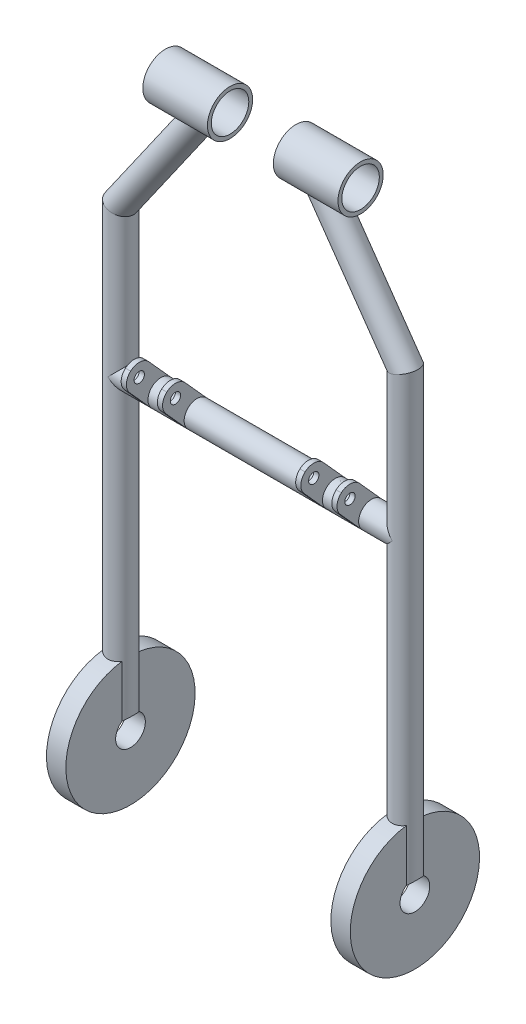
from build123d import *

# Parameters (mm, degrees)
CROQUIS1_R                               = 17.5
CROQUIS1_R_2                             = 14.5
SALIENTE_EXTRUIR1_DEPTH                  = 50
CROQUIS3_R                               = 10
CROQUIS3_R_2                             = 7
CROQUIS4_R                               = 14.5
CORTAR_EXTRUIR1_DEPTH                    = 463.597108113
SALIENTE_EXTRUIR2_REACH                  = 457.593
CROQUIS6_R                               = 17.5
CROQUIS6_R_2                             = 14.5
SALIENTE_EXTRUIR3_DEPTH                  = 50
CROQUIS8_R                               = 10
CROQUIS8_R_2                             = 7
SALIENTE_EXTRUIR4_REACH                  = 410.854
SALIENTE_EXTRUIR5_REACH                  = 495.244
SALIENTE_EXTRUIR5_END_RADIUS             = 10
CROQUIS10_R                              = 10
SALIENTE_EXTRUIR5_DIRECTION_2_REACH      = 495.244
SALIENTE_EXTRUIR5_DIRECTION_2_END_RADIUS = 10
CROQUIS12_R                              = 50
SALIENTE_EXTRUIR6_DEPTH                  = 7.5
CHAFL_N3_SIZE                            = 7
CHAFL_N4_SIZE                            = 7
CROQUIS14_R                              = 50
SALIENTE_EXTRUIR8_DEPTH                  = 7.5
CROQUIS15_R                              = 14.5
CORTAR_EXTRUIR2_DEPTH                    = 542.510293525
SALIENTE_EXTRUIR10_REACH                 = 346.39
SALIENTE_EXTRUIR10_END_RADIUS            = 10
CROQUIS17_W                              = 4
CROQUIS17_H                              = 20
REDONDEO1_R                              = 10
CROQUIS18_R                              = 4
CORTAR_EXTRUIR3_DEPTH                    = 545.263183217
CROQUIS19_R                              = 11.5
CORTAR_EXTRUIR4_DEPTH                    = 563.387736126


# Some blends are built 0.0001 mm under size
with BuildPart() as part:
    # Croquis1 → Saliente-Extruir1 (new body)
    with BuildSketch(Plane(origin=(0, 0, 0), x_dir=(0, 0, -1), z_dir=(1, 0, 0))):
        Circle(CROQUIS1_R)
        Circle(CROQUIS1_R_2, mode=Mode.SUBTRACT)
    extrude(amount=SALIENTE_EXTRUIR1_DEPTH)

    # Barrer1: sweep along a path in Croquis2
    with BuildLine(Plane.XY) as barrer1_path:
        Line((25, -17.5), (-34.517640748, -102.5))
        Line((-34.517640748, -102.5), (-34.517640748, -452.5))
    # Croquis3 → Barrer1 (sweep)
    with BuildSketch(Plane(origin=(25, -17.5, 0), x_dir=(0, 0, 1), z_dir=(-0.5735764363510502, -0.819152044288989, 0))):
        Circle(CROQUIS3_R)
        Circle(CROQUIS3_R_2, mode=Mode.SUBTRACT)
    sweep(path=barrer1_path.line, transition=Transition.RIGHT)

    # Croquis4 → Cortar-Extruir1 (cut, through all)
    with BuildSketch(Plane(origin=(50, 0, 0), x_dir=(0, 0, -1), z_dir=(1, 0, 0))):
        Circle(CROQUIS4_R)
    extrude(amount=-CORTAR_EXTRUIR1_DEPTH, mode=Mode.SUBTRACT)

    # Croquis5 → Saliente-Extruir2 (add, up to next)
    with BuildSketch(Plane(origin=(0.002437777, 0.003481506, 0), x_dir=(0.819152044288989, -0.5735764363510502, 0), z_dir=(0.5735764363510502, 0.819152044288989, 0)), mode=Mode.PRIVATE) as saliente_extruir2_sk1:
        with BuildLine():
            ThreePointArc((40.516388743, 0), (35.831900919, 8.470261525), (26.167322681, 9.004755654))
            add(Edge.make_bspline(
                [(28.247612565, 6.622133693), (27.366057866, 7.858998807), (26.167322681, 9.004755654)],
                knots=[3.529668062, 3.529668062, 3.529668062, 3.682084122, 3.682084122, 3.682084122], degree=2, weights=[1, 0.997097573, 1]))
            ThreePointArc((28.247612565, 6.622133693), (34.585698682, 5.695675256), (37.516388743, 0))
            ThreePointArc((37.516388743, 0), (34.585698682, -5.695675256), (28.247612565, -6.622133693))
            add(Edge.make_bspline(
                [(26.167322681, -9.004755654), (27.366057866, -7.858998807), (28.247612565, -6.622133693)],
                knots=[2.601101186, 2.601101186, 2.601101186, 2.753517245, 2.753517245, 2.753517245], degree=2, weights=[1, 0.997097573, 1]))
            ThreePointArc((26.167322681, -9.004755654), (35.831900919, -8.470261525), (40.516388743, 0))
        make_face()
    saliente_extruir2_tool1 = extrude(saliente_extruir2_sk1.sketch, amount=SALIENTE_EXTRUIR2_REACH, mode=Mode.PRIVATE) - part.part
    add(saliente_extruir2_tool1.solids().sort_by_distance((29.247034, -20.473805, 8.261766))[0])



with BuildPart() as body_2:
    # Croquis6 → Saliente-Extruir3 (new body)
    with BuildSketch(Plane(origin=(101, 0, 0), x_dir=(0, 0, -1), z_dir=(1, 0, 0))):
        Circle(CROQUIS6_R)
        Circle(CROQUIS6_R_2, mode=Mode.SUBTRACT)
    extrude(amount=SALIENTE_EXTRUIR3_DEPTH)

    # Barrer2: sweep along a path in Croquis7
    with BuildLine(Plane.XY) as barrer2_path:
        Line((126, -17.5), (185.517640748, -102.5))
        Line((185.517640748, -102.5), (185.517640748, -452.5))
    # Croquis8 → Barrer2 (sweep)
    with BuildSketch(Plane(origin=(126, -17.5, 0), x_dir=(-0.8191520442889888, -0.5735764363510505, 0), z_dir=(0.5735764363510504, -0.8191520442889887, 0))):
        Circle(CROQUIS8_R)
        Circle(CROQUIS8_R_2, mode=Mode.SUBTRACT)
    sweep(path=barrer2_path.line, transition=Transition.RIGHT)

    # Croquis9 → Saliente-Extruir4 (add, up to next)
    with BuildSketch(Plane(origin=(49.675041402, -70.943311364, 0), x_dir=(0.8191520442889889, 0.5735764363510504, 0), z_dir=(-0.5735764363510504, 0.8191520442889889, 0)), mode=Mode.PRIVATE) as saliente_extruir4_sk1:
        with BuildLine():
            ThreePointArc((95.444346122, 6.622133693), (86.175569944, 0), (95.444346122, -6.622133693))
            add(Edge.make_bspline(
                [(95.444346122, -6.622133693), (96.325900821, -7.858998807), (97.524636006, -9.004755654)],
                knots=[0.388075408, 0.388075408, 0.388075408, 0.540491468, 0.540491468, 0.540491468], degree=2, weights=[1, 0.997097573, 1]))
            ThreePointArc((97.524636006, -9.004755654), (83.175569944, 0), (97.524636006, 9.004755654))
            add(Edge.make_bspline(
                [(97.524636006, 9.004755654), (96.325900821, 7.858998807), (95.444346122, 6.622133693)],
                knots=[5.742693839, 5.742693839, 5.742693839, 5.895109899, 5.895109899, 5.895109899], degree=2, weights=[1, 0.997097573, 1]))
        make_face()
    saliente_extruir4_tool1 = extrude(saliente_extruir4_sk1.sketch, amount=SALIENTE_EXTRUIR4_REACH, mode=Mode.PRIVATE) - body_2.part
    add(saliente_extruir4_tool1.solids().sort_by_distance((128.512844, -15.740488, -8.024705))[0])


with BuildPart() as part_1:
    add(part.part)

    add(body_2.part)  # Saliente-Extruir5 merges body 2
    # Saliente-Extruir5: up to this cylinder (the profile starts outside it)
    saliente_extruir5_end = Plane(origin=(185.517640748, -214.361407, 0), z_dir=(0, -1, 0)) * Cylinder(SALIENTE_EXTRUIR5_END_RADIUS, 1011.488, mode=Mode.PRIVATE)
    # Croquis10 → Saliente-Extruir5 (add, up to the surface)
    with BuildSketch(Plane(origin=(0, 0, 0), x_dir=(0, 0, -1), z_dir=(1, 0, 0)), mode=Mode.PRIVATE) as saliente_extruir5_sk1:
        with Locations(Location((0, -214.361406616, 0), (0, 0, 180))):
            Circle(CROQUIS10_R)
    saliente_extruir5_tool1 = extrude(saliente_extruir5_sk1.sketch, amount=SALIENTE_EXTRUIR5_REACH, mode=Mode.PRIVATE) - saliente_extruir5_end
    add(saliente_extruir5_tool1.solids().sort_by_distance((0, -214.361407, 0))[0])

    # Saliente-Extruir5 direction 2: up to this cylinder (the profile starts outside it)
    saliente_extruir5_direction_2_end = Plane(origin=(-34.517640748, -214.361407, 0), z_dir=(0, -1, 0)) * Cylinder(SALIENTE_EXTRUIR5_DIRECTION_2_END_RADIUS, 1011.488, mode=Mode.PRIVATE)
    # Croquis10 → Saliente-Extruir5 direction 2 (add, up to the surface)
    with BuildSketch(Plane(origin=(0, 0, 0), x_dir=(0, 0, -1), z_dir=(1, 0, 0)), mode=Mode.PRIVATE) as saliente_extruir5_direction_2_sk1:
        with Locations(Location((0, -214.361406616, 0), (0, 0, 180))):
            Circle(CROQUIS10_R)
    saliente_extruir5_direction_2_tool1 = extrude(saliente_extruir5_direction_2_sk1.sketch, amount=-SALIENTE_EXTRUIR5_DIRECTION_2_REACH, mode=Mode.PRIVATE) - saliente_extruir5_direction_2_end
    add(saliente_extruir5_direction_2_tool1.solids().sort_by_distance((0, -214.361407, 0))[0])

    # Croquis12 → Saliente-Extruir6 (add, symmetric)
    with BuildSketch(Plane(origin=(-34.517640748, -452.5, 0), x_dir=(0, 0, 1), z_dir=(-1, 0, 0))):
        Circle(CROQUIS12_R)
    extrude(amount=SALIENTE_EXTRUIR6_DEPTH, both=True)

    # Chaflán3
    # the kernel refuses this chamfer: 7 mm, written as the material it takes off along each edge
    with BuildSketch(Plane(origin=(-34.517640748, -452.5, 0), x_dir=(-0.8149995055936188, 0, -0.5794616517787495), z_dir=(-0.5794616517787495, 0, 0.8149995055936188))) as chafl_n3_piece_1_section:
        Polygon((10, -CHAFL_N3_SIZE), (10 - CHAFL_N3_SIZE, 0), (10, 0), align=None)
    chafl_n3_piece_1 = revolve(axis=Axis((-34.517640748, -452.5, 0), (0, -1, 0)), revolution_arc=289.174626006, mode=Mode.PRIVATE)
    chafl_n3_piece_1 = split(chafl_n3_piece_1, bisect_by=Plane(origin=(-27.017640748, -449.451263522, 0), z_dir=(1, 0, 0)), keep=Keep.TOP, mode=Mode.PRIVATE)
    add(chafl_n3_piece_1, mode=Mode.SUBTRACT)

    # Chaflán4
    # the kernel refuses this chamfer: 7 mm, written as the material it takes off along each edge
    with BuildSketch(Plane(origin=(-34.517640748, -452.5, 0), x_dir=(0.8149995055936291, 0, 0.5794616517787353), z_dir=(0.5794616517787353, 0, -0.8149995055936291))) as chafl_n4_piece_1_section:
        Polygon((10, -CHAFL_N4_SIZE), (10 - CHAFL_N4_SIZE, 0), (10, 0), align=None)
    chafl_n4_piece_1 = revolve(axis=Axis((-34.517640748, -452.5, 0), (0, -1, 0)), revolution_arc=289.174626006, mode=Mode.PRIVATE)
    chafl_n4_piece_1 = split(chafl_n4_piece_1, bisect_by=Plane(origin=(-42.017640748, -449.451263522, 0), z_dir=(-1, 0, 0)), keep=Keep.TOP, mode=Mode.PRIVATE)
    add(chafl_n4_piece_1, mode=Mode.SUBTRACT)

    # Croquis14 → Saliente-Extruir8 (add, symmetric)
    with BuildSketch(Plane(origin=(185.517640748, -452.5, 0), x_dir=(0, 0, 1), z_dir=(-1, 0, 0))):
        Circle(CROQUIS14_R)
    extrude(amount=SALIENTE_EXTRUIR8_DEPTH, both=True)

    # Croquis15 → Cortar-Extruir2 (cut, through all)
    with BuildSketch(Plane(origin=(151, 0, 0), x_dir=(0, 0, -1), z_dir=(1, 0, 0))):
        Circle(CROQUIS15_R)
    extrude(amount=-CORTAR_EXTRUIR2_DEPTH, mode=Mode.SUBTRACT)

    # Saliente-Extruir10: up to this cylinder (the profile starts outside it)
    saliente_extruir10_end = Plane(origin=(76, -214.361406616, 0), z_dir=(-1, 0, 0)) * Cylinder(SALIENTE_EXTRUIR10_END_RADIUS, 876.78, mode=Mode.PRIVATE)
    # Croquis17 → Saliente-Extruir10 (add, up to the surface)
    with BuildSketch(Plane(origin=(75, -188.351337725, 23.419571223), x_dir=(1, 0, 0), z_dir=(0, 0.7431448254773934, 0.6691306063588592)), mode=Mode.PRIVATE) as saliente_extruir10_sk1:
        with Locations((-80.5, 0)):
            Rectangle(CROQUIS17_W, CROQUIS17_H)
    saliente_extruir10_tool1 = extrude(saliente_extruir10_sk1.sketch, amount=-SALIENTE_EXTRUIR10_REACH, mode=Mode.PRIVATE) - saliente_extruir10_end
    add(saliente_extruir10_tool1.solids().sort_by_distance((-5.5, -188.351338, 23.419571))[0])
    # Croquis17 → Saliente-Extruir10 (add, up to the surface)
    with BuildSketch(Plane(origin=(75, -188.351337725, 23.419571223), x_dir=(1, 0, 0), z_dir=(0, 0.7431448254773934, 0.6691306063588592)), mode=Mode.PRIVATE) as saliente_extruir10_sk2:
        with Locations((-52.5, 0)):
            Rectangle(CROQUIS17_W, CROQUIS17_H)
    saliente_extruir10_tool2 = extrude(saliente_extruir10_sk2.sketch, amount=-SALIENTE_EXTRUIR10_REACH, mode=Mode.PRIVATE) - saliente_extruir10_end
    add(saliente_extruir10_tool2.solids().sort_by_distance((22.5, -188.351338, 23.419571))[0])
    # Croquis17 → Saliente-Extruir10 (add, up to the surface)
    with BuildSketch(Plane(origin=(75, -188.351337725, 23.419571223), x_dir=(1, 0, 0), z_dir=(0, 0.7431448254773934, 0.6691306063588592)), mode=Mode.PRIVATE) as saliente_extruir10_sk3:
        with Locations((54.5, 0)):
            Rectangle(CROQUIS17_W, CROQUIS17_H)
    saliente_extruir10_tool3 = extrude(saliente_extruir10_sk3.sketch, amount=-SALIENTE_EXTRUIR10_REACH, mode=Mode.PRIVATE) - saliente_extruir10_end
    add(saliente_extruir10_tool3.solids().sort_by_distance((129.5, -188.351338, 23.419571))[0])
    # Croquis17 → Saliente-Extruir10 (add, up to the surface)
    with BuildSketch(Plane(origin=(75, -188.351337725, 23.419571223), x_dir=(1, 0, 0), z_dir=(0, 0.7431448254773934, 0.6691306063588592)), mode=Mode.PRIVATE) as saliente_extruir10_sk4:
        with Locations((82.5, 0)):
            Rectangle(CROQUIS17_W, CROQUIS17_H)
    saliente_extruir10_tool4 = extrude(saliente_extruir10_sk4.sketch, amount=-SALIENTE_EXTRUIR10_REACH, mode=Mode.PRIVATE) - saliente_extruir10_end
    add(saliente_extruir10_tool4.solids().sort_by_distance((157.5, -188.351338, 23.419571))[0])

    # Redondeo1
    redondeo1_edges = [part_1.edges().sort_by_distance(p)[0] for p in [
        (157.5, -195.042643788, 30.851019477),
        (157.5, -181.660031661, 15.988122968),
        (129.5, -195.042643788, 30.851019477),
        (129.5, -181.660031661, 15.988122968),
        (-5.5, -195.042643788, 30.851019477),
        (-5.5, -181.660031661, 15.988122968),
        (22.5, -181.660031661, 15.988122968),
        (22.5, -195.042643788, 30.851019477),
    ]]
    fillet(redondeo1_edges, radius=REDONDEO1_R - 0.0001)  # a hair under: the kernel refuses the full size

    # Croquis18 → Cortar-Extruir3 (cut, through all)
    with BuildSketch(Plane.ZY.offset(7.5)):
        with Locations((16.728265159, -195.782785979)):
            Circle(CROQUIS18_R)
    extrude(amount=-CORTAR_EXTRUIR3_DEPTH, mode=Mode.SUBTRACT)

    # Croquis19 → Cortar-Extruir4 (cut, through all)
    with BuildSketch(Plane.ZY.offset(52.017640748)):
        with Locations(Location((0, -452.5, 0), (0, 0, 125.111070991))):
            Circle(CROQUIS19_R)
    extrude(amount=-CORTAR_EXTRUIR4_DEPTH, mode=Mode.SUBTRACT)


solid = part_1.part
